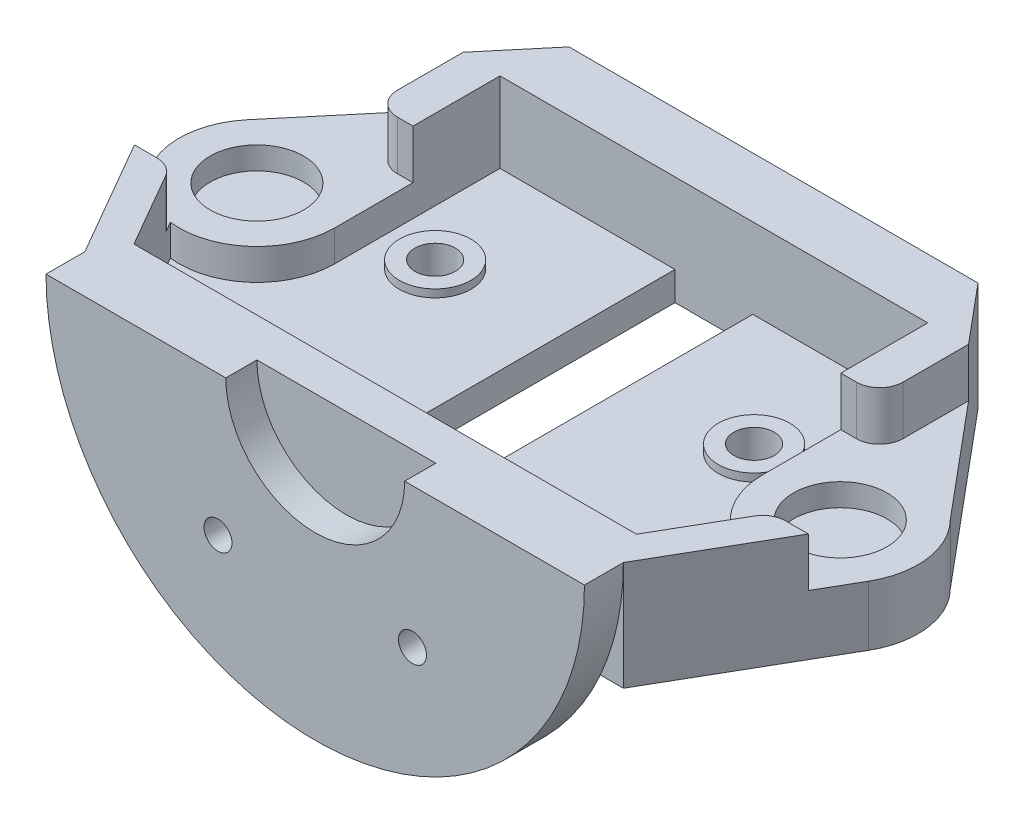
from build123d import *

# Parameters (mm, degrees)
EXTRUDE_1_DEPTH     = 14
CUT_EXTRUDE_START   = -6.3
CUT_EXTRUDE_1_DEPTH = 6.3
CUT_EXTRUDE_START_2 = -3
CUT_EXTRUDE_2_DEPTH = 3
SKETCH_4_R          = 6.01
CUT_EXTRUDE_3_DEPTH = 2.9
CUT_EXTRUDE_4_REACH = 105.197
SKETCH_5_R          = 2.6
CUT_EXTRUDE_START_3 = -1
SKETCH_6_R          = 4.6
CUT_EXTRUDE_6_DEPTH = 1
EXTRUDE_2_DEPTH     = 5
SKETCH_8_R          = 11.5
CUT_EXTRUDE_7_DEPTH = 4
CUT_EXTRUDE_8_REACH = 106.824
SKETCH_9_R          = 1.8
FILLET_1_R          = 3
CUT_EXTRUDE_9_REACH = 107.614
SKETCH_11_W         = 10
SKETCH_11_H         = 42.251878887


with BuildPart() as part:
    # 草图1 → 凸台-拉伸1 (new body)
    with BuildSketch(Plane(origin=(0, 0, 0), x_dir=(1, 0, 0), z_dir=(0, 1, 0))):
        with BuildLine():
            Line((13.709398988, 53.916079783), (-5.160444431, 31.427876097))
            ThreePointArc((-5.160444431, 31.427876097), (-7.461946981, 25.871557427), (-6.160254038, 20))
            Line((-6.160254038, 20), (5.386751346, 0))
            Line((5.386751346, 0), (74.613248654, 0))
            Line((74.613248654, 0), (86.160254038, 20))
            ThreePointArc((86.160254038, 20), (87.414448614, 26.305261922), (84.571067812, 32.071067812))
            Line((84.571067812, 32.071067812), (66.290601012, 53.916079783))
            Line((66.290601012, 53.916079783), (13.709398988, 53.916079783))
        make_face()
    extrude(amount=EXTRUDE_1_DEPTH)

    # 草图2 → 切除-拉伸1 (cut)
    with BuildSketch(Plane(origin=(0, 14, 0), x_dir=(1, 0, 0), z_dir=(0, 1, 0)).offset(CUT_EXTRUDE_START)):
        with BuildLine():
            Line((-3.314954576, 15.07179677), (1.303847577, 15.07179677))
            Line((1.303847577, 15.07179677), (7.696152423, 4))
            Line((7.696152423, 4), (72.303847577, 4))
            Line((72.303847577, 4), (78.696152423, 15.07179677))
            Line((78.696152423, 15.07179677), (83.314954576, 15.07179677))
            Line((83.314954576, 15.07179677), (86.160254038, 20))
            ThreePointArc((86.160254038, 20), (87.461946981, 25.871557427), (85.160444431, 31.427876097))
            ThreePointArc((85.160444431, 31.427876097), (84.872773368, 31.755902076), (84.571067812, 32.071067812))
            Line((84.571067812, 32.071067812), (72.5, 46.495897536))
            Line((72.5, 46.495897536), (72.5, 35.067052168))
            Line((72.5, 35.067052168), (67.5, 35.067052168))
            Line((67.5, 35.067052168), (67.5, 46.251878887))
            Line((67.5, 46.251878887), (12.5, 46.251878887))
            Line((12.5, 46.251878887), (12.5, 35.067052168))
            Line((12.5, 35.067052168), (7.5, 35.067052168))
            Line((7.5, 35.067052168), (7.5, 46.516006232))
            Line((7.5, 46.516006232), (-5.160444431, 31.427876097))
            ThreePointArc((-5.160444431, 31.427876097), (-7.461946981, 25.871557427), (-6.160254038, 20))
            Line((-6.160254038, 20), (-3.314954576, 15.07179677))
        make_face()
    extrude(amount=CUT_EXTRUDE_1_DEPTH, mode=Mode.SUBTRACT)

    # 草图3 → 切除-拉伸2 (cut)
    with BuildSketch(Plane(origin=(0, 7.7, 0), x_dir=(1, 0, 0), z_dir=(0, 1, 0)).offset(CUT_EXTRUDE_START_2)):
        with BuildLine():
            Line((72.303847577, 4), (78.696152423, 15.07179677))
            ThreePointArc((78.696152423, 15.07179677), (70.865300468, 17.517970722), (67.5, 25))
            Line((67.5, 25), (67.5, 35.067052168))
            Line((67.5, 35.067052168), (67.5, 46.251878887))
            Line((67.5, 46.251878887), (12.5, 46.251878887))
            Line((12.5, 46.251878887), (12.5, 35.067052168))
            Line((12.5, 35.067052168), (12.5, 25))
            ThreePointArc((12.5, 25), (9.134699532, 17.517970722), (1.303847577, 15.07179677))
            Line((1.303847577, 15.07179677), (7.696152423, 4))
            Line((7.696152423, 4), (72.303847577, 4))
        make_face()
    extrude(amount=CUT_EXTRUDE_2_DEPTH, mode=Mode.SUBTRACT)

    # 草图4 → 切除-拉伸3 (cut)
    with BuildSketch(Plane(origin=(0, 7.7, 0), x_dir=(1, 0, 0), z_dir=(0, 1, 0))):
        with Locations((2.5, 25)):
            Circle(SKETCH_4_R)
        with Locations((77.5, 25)):
            Circle(SKETCH_4_R)
    extrude(amount=-CUT_EXTRUDE_3_DEPTH, mode=Mode.SUBTRACT)

    # 草图5 → 切除-拉伸4 (cut, up to next)
    with BuildSketch(Plane(origin=(0, 4.7, 0), x_dir=(1, 0, 0), z_dir=(0, 1, 0)), mode=Mode.PRIVATE) as cut_extrude_4_sk1:
        with Locations((19.5, 30.916079783)):
            Circle(SKETCH_5_R)
    cut_extrude_4_tool1 = extrude(cut_extrude_4_sk1.sketch, amount=-CUT_EXTRUDE_4_REACH, mode=Mode.PRIVATE) & part.part
    # 草图5 → 切除-拉伸4 (cut, up to next)
    with BuildSketch(Plane(origin=(0, 4.7, 0), x_dir=(1, 0, 0), z_dir=(0, 1, 0)), mode=Mode.PRIVATE) as cut_extrude_4_sk2:
        with Locations((60.5, 30.916079783)):
            Circle(SKETCH_5_R)
    cut_extrude_4_tool2 = extrude(cut_extrude_4_sk2.sketch, amount=-CUT_EXTRUDE_4_REACH, mode=Mode.PRIVATE) & part.part
    add(cut_extrude_4_tool1.solids().sort_by_distance((19.5, 4.7, -30.91608))[0], mode=Mode.SUBTRACT)
    add(cut_extrude_4_tool2.solids().sort_by_distance((60.5, 4.7, -30.91608))[0], mode=Mode.SUBTRACT)

    # 草图6 → 切除-拉伸6 (cut)
    with BuildSketch(Plane(origin=(0, 4.7, 0), x_dir=(1, 0, 0), z_dir=(0, 1, 0)).offset(CUT_EXTRUDE_START_3)):
        with BuildLine():
            Line((72.303847577, 4), (78.696152423, 15.07179677))
            ThreePointArc((78.696152423, 15.07179677), (70.865300468, 17.517970722), (67.5, 25))
            Line((67.5, 25), (67.5, 46.251878887))
            Line((67.5, 46.251878887), (12.5, 46.251878887))
            Line((12.5, 46.251878887), (12.5, 25))
            ThreePointArc((12.5, 25), (9.134699532, 17.517970722), (1.303847577, 15.07179677))
            Line((1.303847577, 15.07179677), (7.696152423, 4))
            Line((7.696152423, 4), (72.303847577, 4))
        make_face()
        with Locations((19.5, 30.916079783)):
            Circle(SKETCH_6_R, mode=Mode.SUBTRACT)
        with Locations((60.5, 30.916079783)):
            Circle(SKETCH_6_R, mode=Mode.SUBTRACT)
    extrude(amount=CUT_EXTRUDE_6_DEPTH, mode=Mode.SUBTRACT)

    # 草图7 → 凸台-拉伸2 (add)
    with BuildSketch(Plane.XY):
        with BuildLine():
            Line((5.386751346, 14), (74.613248654, 14))
            ThreePointArc((74.613248654, 14), (40, -20.613248654), (5.386751346, 14))
        make_face()
    extrude(amount=EXTRUDE_2_DEPTH)

    # 草图8 → 切除-拉伸7 (cut)
    with BuildSketch(Plane.XY.offset(5)):
        with Locations((40, 14)):
            Circle(SKETCH_8_R)
    extrude(amount=-CUT_EXTRUDE_7_DEPTH, mode=Mode.SUBTRACT)

    # 草图9 → 切除-拉伸8 (cut, up to next)
    with BuildSketch(Plane(origin=(0, 0, 0), x_dir=(-1, 0, 0), z_dir=(0, 0, -1)), mode=Mode.PRIVATE) as cut_extrude_8_sk1:
        with Locations((-52.5, -4)):
            Circle(SKETCH_9_R)
    cut_extrude_8_tool1 = extrude(cut_extrude_8_sk1.sketch, amount=-CUT_EXTRUDE_8_REACH, mode=Mode.PRIVATE) & part.part
    # 草图9 → 切除-拉伸8 (cut, up to next)
    with BuildSketch(Plane(origin=(0, 0, 0), x_dir=(-1, 0, 0), z_dir=(0, 0, -1)), mode=Mode.PRIVATE) as cut_extrude_8_sk2:
        with Locations((-27.5, -4)):
            Circle(SKETCH_9_R)
    cut_extrude_8_tool2 = extrude(cut_extrude_8_sk2.sketch, amount=-CUT_EXTRUDE_8_REACH, mode=Mode.PRIVATE) & part.part
    add(cut_extrude_8_tool1.solids().sort_by_distance((52.5, -4, 0))[0], mode=Mode.SUBTRACT)
    add(cut_extrude_8_tool2.solids().sort_by_distance((27.5, -4, 0))[0], mode=Mode.SUBTRACT)

    # 圆角1
    fillet_1_edges = [part.edges().sort_by_distance(p)[0] for p in [
        (78.696152423, 10.85, -15.07179677),
        (1.303847577, 10.85, -15.07179677),
        (72.5, 10.85, -35.067052168),
        (7.5, 10.85, -35.067052168),
    ]]
    fillet(fillet_1_edges, radius=FILLET_1_R)

    # 草图11 → 切除-拉伸9 (cut, up to next)
    with BuildSketch(Plane(origin=(0, 3.7, 0), x_dir=(1, 0, 0), z_dir=(0, 1, 0)), mode=Mode.PRIVATE) as cut_extrude_9_sk1:
        with Locations((40, 25.125939444)):
            Rectangle(SKETCH_11_W, SKETCH_11_H)
    cut_extrude_9_tool1 = extrude(cut_extrude_9_sk1.sketch, amount=-CUT_EXTRUDE_9_REACH, mode=Mode.PRIVATE) & part.part
    add(cut_extrude_9_tool1.solids().sort_by_distance((40, 3.7, -25.125939))[0], mode=Mode.SUBTRACT)


solid = part.part
